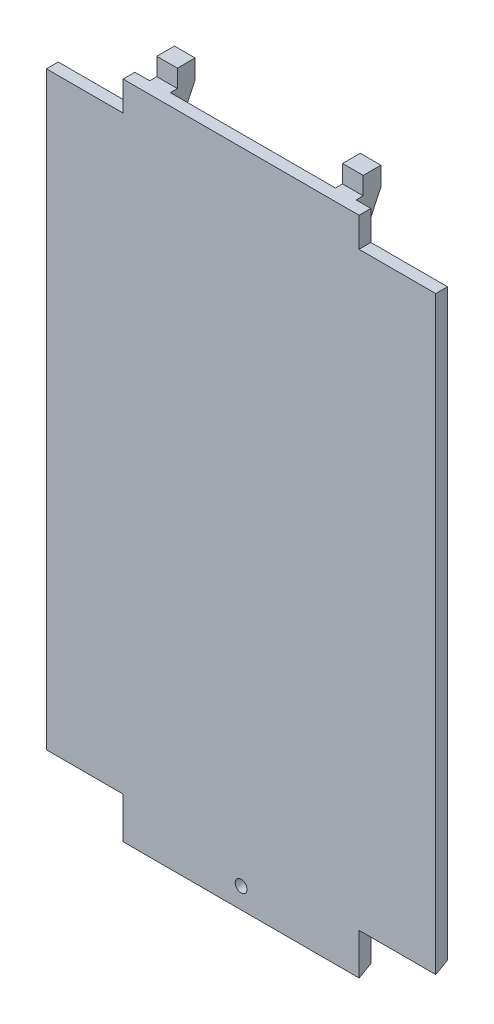
from build123d import *
from OCP.BRepFilletAPI import BRepFilletAPI_MakeChamfer

# Parameters (mm, degrees)
SKETCH_1_W          = 40
SKETCH_1_H          = 112
EXTRUDE_1_DEPTH     = 3
SKETCH_2_R          = 1
CUT_EXTRUDE_1_DEPTH = 3
SKETCH_3_W          = 3.5
SKETCH_3_H          = 10
EXTRUDE_2_DEPTH     = 3.2
CHAMFER_1_SIZE      = 6.8
CHAMFER_1_SIZE2     = 3.170892075
SKETCH_4_W          = 66
SKETCH_4_H          = 100
EXTRUDE_3_DEPTH     = 3
SKETCH_5_W          = 42.259647881
SKETCH_5_H          = 3.16572893
CUT_EXTRUDE_2_DEPTH = 0.2
CHAMFER_3_SIZE      = 1
CHAMFER_4_SIZE      = 2.944486373
CHAMFER_4_SIZE_2    = 1.7


with BuildPart() as part:
    # 草圖1 → 填料-伸長1 (new body)
    with BuildSketch(Plane.XY):
        with Locations((20, 56)):
            Rectangle(SKETCH_1_W, SKETCH_1_H)
    extrude(amount=EXTRUDE_1_DEPTH)

    # 草圖2 → 除料-伸長1 (cut)
    with BuildSketch(Plane.XY):
        with Locations((20, 3.5)):
            Circle(SKETCH_2_R)
    extrude(amount=CUT_EXTRUDE_1_DEPTH, mode=Mode.SUBTRACT)

    # 草圖3 → 填料-伸長2 (add)
    with BuildSketch(Plane.XY):
        with Locations((35.75, 110)):
            Rectangle(SKETCH_3_W, SKETCH_3_H)
        with Locations((4.25, 110)):
            Rectangle(SKETCH_3_W, SKETCH_3_H)
    extrude(amount=-EXTRUDE_2_DEPTH)

    # 導角1: one chamfer whose edges measure the first distance from different faces: ONE call of the kernel's chamfer builder (chamfer() names one face for all edges)
    chamfer_1_edges_1 = [part.edges().sort_by_distance(p)[0] for p in [
        (35.75, 105, -3.2),
    ]]
    chamfer_1_side_1 = [part.faces().sort_by_distance(p)[0] for p in [
        (35.75, 110, -3.2),
    ]]
    chamfer_1_edges_2 = [part.edges().sort_by_distance(p)[0] for p in [
        (4.25, 105, -3.2),
    ]]
    chamfer_1_side_2 = [part.faces().sort_by_distance(p)[0] for p in [
        (4.25, 110, -3.2),
    ]]
    chamfer_1 = BRepFilletAPI_MakeChamfer(part.part.solid().wrapped)
    for e in chamfer_1_edges_1:
        chamfer_1.Add(CHAMFER_1_SIZE, CHAMFER_1_SIZE2, e.wrapped, chamfer_1_side_1[0].wrapped)  # the first distance lies on this face
    for e in chamfer_1_edges_2:
        chamfer_1.Add(CHAMFER_1_SIZE, CHAMFER_1_SIZE2, e.wrapped, chamfer_1_side_2[0].wrapped)  # the first distance lies on this face
    add(Compound.cast(chamfer_1.Shape()), mode=Mode.REPLACE)

    # 草圖4 → 填料-伸長3 (add)
    with BuildSketch(Plane.XY):
        with Locations((20, 57)):
            Rectangle(SKETCH_4_W, SKETCH_4_H)
    extrude(amount=EXTRUDE_3_DEPTH)

    # 草圖5 → 除料-伸長2 (cut)
    with BuildSketch(Plane.XY):
        with Locations((18.12982394, 113.582864465)):
            Rectangle(SKETCH_5_W, SKETCH_5_H)
    extrude(amount=-CUT_EXTRUDE_2_DEPTH, mode=Mode.SUBTRACT)

    # 導角3
    chamfer_3_edges = [part.edges().sort_by_distance(p)[0] for p in [
        (20, 112, 0),
        (1.25, 112, 0),
        (38.75, 112, 0),
        (40, 3.5, 0),
        (0, 109.5, 0),
        (40, 109.5, 0),
        (0, 3.5, 0),
        (-6.5, 107, 0),
        (46.5, 107, 0),
        (53, 57, 0),
        (-13, 57, 0),
    ]]
    chamfer(chamfer_3_edges, length=CHAMFER_3_SIZE)

    # 導角4
    # the kernel refuses this chamfer: 2.944486373, 1.7 mm, written as the material it takes off along each edge
    with BuildSketch(Plane(origin=(8.61763875, 7, 0), x_dir=(0, -0.01932676561270069, 0.9998132206222079), z_dir=(-1, 0, 0))) as chamfer_4_piece_1_section:
        Polygon((CHAMFER_4_SIZE * 0.999813220577, CHAMFER_4_SIZE * 0.0193267656118), (-CHAMFER_4_SIZE_2 * 0.0193267656127, CHAMFER_4_SIZE_2 * 0.999813220622), (0, 0), align=None)
    chamfer_4_piece_1 = extrude(amount=28.2352775, mode=Mode.PRIVATE)
    chamfer_4_piece_1 = split(chamfer_4_piece_1, bisect_by=Plane(origin=(0.556062959, 7.780962214, 0.443937041), z_dir=(-0.7071067811865476, 0, -0.7071067811865476)), keep=Keep.TOP, mode=Mode.PRIVATE)
    chamfer_4_piece_1 = split(chamfer_4_piece_1, bisect_by=Plane(origin=(0, 7.780962214, 0.258582722), z_dir=(1, 0, 0)), keep=Keep.TOP, mode=Mode.PRIVATE)
    add(chamfer_4_piece_1, mode=Mode.SUBTRACT)
    with BuildSketch(Plane(origin=(8.61763875, 7, 0), x_dir=(0, -0.01932676561270069, 0.9998132206222079), z_dir=(-1, 0, 0))) as chamfer_4_piece_2_section:
        Polygon((CHAMFER_4_SIZE * 0.999813220577, CHAMFER_4_SIZE * 0.0193267656118), (-CHAMFER_4_SIZE_2 * 0.0193267656127, CHAMFER_4_SIZE_2 * 0.999813220622), (0, 0), align=None)
    chamfer_4_piece_2 = extrude(amount=28.2352775, mode=Mode.PRIVATE)
    chamfer_4_piece_2 = split(chamfer_4_piece_2, bisect_by=Plane(origin=(-0.79990122, 7.215436489, 1.79990122), z_dir=(0.7071067811865476, 0, 0.7071067811865476)), keep=Keep.TOP, mode=Mode.PRIVATE)
    chamfer_4_piece_2 = split(chamfer_4_piece_2, bisect_by=Plane(origin=(0, 7.215436489, 2.06653496), z_dir=(-1, 0, 0)), keep=Keep.TOP, mode=Mode.PRIVATE)
    add(chamfer_4_piece_2, mode=Mode.SUBTRACT)
    with BuildSketch(Plane(origin=(8.61763875, 7, 0), x_dir=(0, -0.01932676561270069, 0.9998132206222079), z_dir=(-1, 0, 0))) as chamfer_4_piece_3_section:
        Polygon((CHAMFER_4_SIZE * 0.999813220577, CHAMFER_4_SIZE * 0.0193267656118), (-CHAMFER_4_SIZE_2 * 0.0193267656127, CHAMFER_4_SIZE_2 * 0.999813220622), (0, 0), align=None)
    chamfer_4_piece_3 = extrude(amount=28.2352775, mode=Mode.PRIVATE)
    chamfer_4_piece_3 = split(chamfer_4_piece_3, bisect_by=Plane(origin=(-4.964199095, 7.550450485, 5.964199095), z_dir=(-0.7071067811865476, 0, -0.7071067811865476)), keep=Keep.TOP, mode=Mode.PRIVATE)
    chamfer_4_piece_3 = split(chamfer_4_piece_3, bisect_by=Plane(origin=(0, 7.550450485, 0.970145216), z_dir=(-1, 0, 0)), keep=Keep.TOP, mode=Mode.PRIVATE)
    add(chamfer_4_piece_3, mode=Mode.SUBTRACT)
    with BuildSketch(Plane(origin=(59.61763875, 7, 0), x_dir=(0, -0.01932676561270069, 0.9998132206222079), z_dir=(-1, 0, 0))) as chamfer_4_piece_4_section:
        Polygon((CHAMFER_4_SIZE * 0.999813220577, CHAMFER_4_SIZE * 0.0193267656118), (-CHAMFER_4_SIZE_2 * 0.0193267656127, CHAMFER_4_SIZE_2 * 0.999813220622), (0, 0), align=None)
    chamfer_4_piece_4 = extrude(amount=28.2352775, mode=Mode.PRIVATE)
    chamfer_4_piece_4 = split(chamfer_4_piece_4, bisect_by=Plane(origin=(40, 7.550450485, 0.970145216), z_dir=(1, 0, 0)), keep=Keep.TOP, mode=Mode.PRIVATE)
    chamfer_4_piece_4 = split(chamfer_4_piece_4, bisect_by=Plane(origin=(44.964199095, 7.550450485, 5.964199095), z_dir=(0.7071067811865476, 0, -0.7071067811865476)), keep=Keep.TOP, mode=Mode.PRIVATE)
    add(chamfer_4_piece_4, mode=Mode.SUBTRACT)
    with BuildSketch(Plane(origin=(59.61763875, 7, 0), x_dir=(0, -0.01932676561270069, 0.9998132206222079), z_dir=(-1, 0, 0))) as chamfer_4_piece_5_section:
        Polygon((CHAMFER_4_SIZE * 0.999813220577, CHAMFER_4_SIZE * 0.0193267656118), (-CHAMFER_4_SIZE_2 * 0.0193267656127, CHAMFER_4_SIZE_2 * 0.999813220622), (0, 0), align=None)
    chamfer_4_piece_5 = extrude(amount=28.2352775, mode=Mode.PRIVATE)
    chamfer_4_piece_5 = split(chamfer_4_piece_5, bisect_by=Plane(origin=(40, 7.780962214, 0.258582722), z_dir=(-1, 0, 0)), keep=Keep.TOP, mode=Mode.PRIVATE)
    chamfer_4_piece_5 = split(chamfer_4_piece_5, bisect_by=Plane(origin=(39.443937041, 7.780962214, 0.443937041), z_dir=(0.7071067811865476, 0, -0.7071067811865476)), keep=Keep.TOP, mode=Mode.PRIVATE)
    add(chamfer_4_piece_5, mode=Mode.SUBTRACT)
    with BuildSketch(Plane(origin=(59.61763875, 7, 0), x_dir=(0, -0.01932676561270069, 0.9998132206222079), z_dir=(-1, 0, 0))) as chamfer_4_piece_6_section:
        Polygon((CHAMFER_4_SIZE * 0.999813220577, CHAMFER_4_SIZE * 0.0193267656118), (-CHAMFER_4_SIZE_2 * 0.0193267656127, CHAMFER_4_SIZE_2 * 0.999813220622), (0, 0), align=None)
    chamfer_4_piece_6 = extrude(amount=28.2352775, mode=Mode.PRIVATE)
    chamfer_4_piece_6 = split(chamfer_4_piece_6, bisect_by=Plane(origin=(40, 7.215436489, 2.06653496), z_dir=(1, 0, 0)), keep=Keep.TOP, mode=Mode.PRIVATE)
    chamfer_4_piece_6 = split(chamfer_4_piece_6, bisect_by=Plane(origin=(40.79990122, 7.215436489, 1.79990122), z_dir=(-0.7071067811865476, 0, 0.7071067811865476)), keep=Keep.TOP, mode=Mode.PRIVATE)
    add(chamfer_4_piece_6, mode=Mode.SUBTRACT)
    with BuildSketch(Plane(origin=(-6.61763875, 0, 0), x_dir=(0, -0.019326765612700646, 0.9998132206222079), z_dir=(1, 0, 0))) as chamfer_4_piece_7:
        Polygon((CHAMFER_4_SIZE * 0.999813220577, -CHAMFER_4_SIZE * 0.0193267656118), (-CHAMFER_4_SIZE_2 * 0.0193267656127, -CHAMFER_4_SIZE_2 * 0.999813220622), (0, 0), align=None)
    extrude(amount=53.2352775, mode=Mode.SUBTRACT)


solid = part.part
